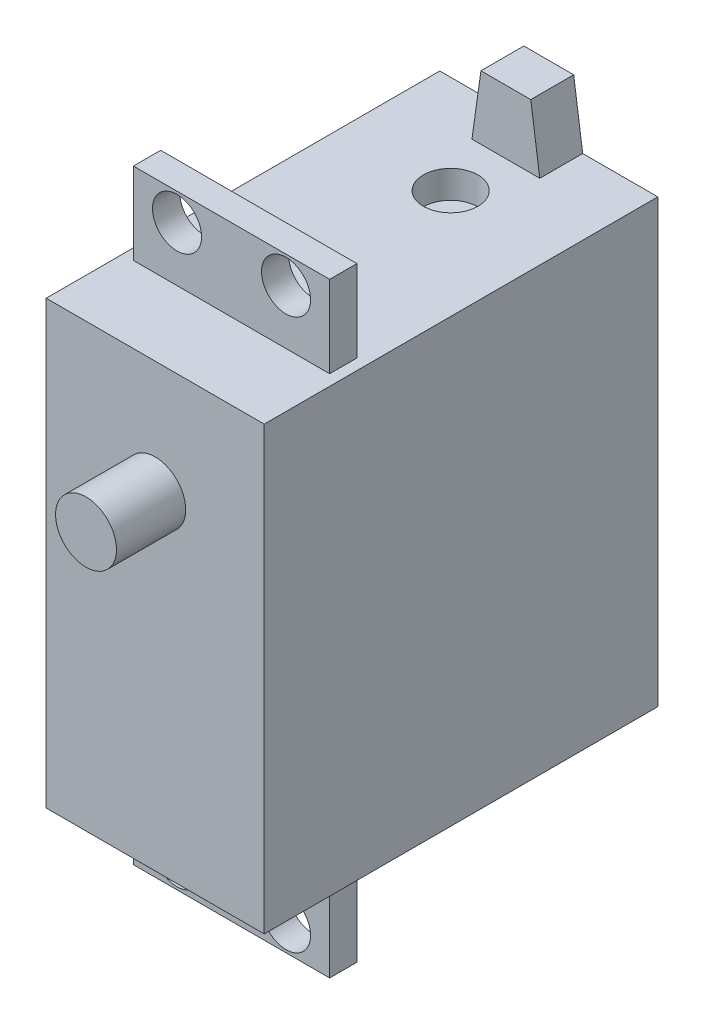
from build123d import *

# Parameters (mm, degrees)
SKETCH1_W           = 20
SKETCH1_H           = 40.5
BOSS_EXTRUDE1_DEPTH = 9.50000005
SKETCH2_W           = 20
SKETCH2_H           = 40.5
BOSS_EXTRUDE2_DEPTH = 17.1
SKETCH3_R           = 2.25
BOSS_EXTRUDE3_DEPTH = 2.5
SKETCH4_R           = 2.794
BOSS_EXTRUDE4_DEPTH = 6.349000002
SKETCH7_R           = 2.5
CUT_EXTRUDE1_DEPTH  = 2.54
BOSS_EXTRUDE6_DEPTH = 3.937


with BuildPart() as part:
    # Sketch1 → Boss-Extrude1 (new, symmetric)
    with BuildSketch(Plane.XY):
        with Locations((10, 20.25)):
            Rectangle(SKETCH1_W, SKETCH1_H)
    extrude(amount=BOSS_EXTRUDE1_DEPTH, both=True)

    # Sketch2 → Boss-Extrude2 (add)
    with BuildSketch(Plane(origin=(0, 0, -9.50000005), x_dir=(-1, 0, 0), z_dir=(0, 0, -1))):
        with Locations((-10, 20.25)):
            Rectangle(SKETCH2_W, SKETCH2_H)
    extrude(amount=BOSS_EXTRUDE2_DEPTH)

    # Sketch3 → Boss-Extrude3 (add)
    with BuildSketch(Plane.XY):
        Polygon((19, 0), (19, -7.5), (1, -7.5), (1, 0), (0, 0), (0, 40.5), (1, 40.5), (1, 48), (19, 48), (19, 40.5), (20, 40.5), (20, 0), align=None)
        with Locations((5, -5)):
            Circle(SKETCH3_R, mode=Mode.SUBTRACT)
        with Locations((15, -5)):
            Circle(SKETCH3_R, mode=Mode.SUBTRACT)
        with Locations((5, 45.5)):
            Circle(SKETCH3_R, mode=Mode.SUBTRACT)
        with Locations((15, 45.5)):
            Circle(SKETCH3_R, mode=Mode.SUBTRACT)
    extrude(amount=BOSS_EXTRUDE3_DEPTH)

    # Sketch4 → Boss-Extrude4 (add)
    with BuildSketch(Plane.XY.offset(9.50000005)):
        with Locations((10, 30.1)):
            Circle(SKETCH4_R)
    extrude(amount=BOSS_EXTRUDE4_DEPTH)

    # Sketch7 → Cut-Extrude1 (cut)
    with BuildSketch(Plane(origin=(0, 40.5, 0), x_dir=(1, 0, 0), z_dir=(0, 1, 0))):
        with Locations((10, 17.60000005)):
            Circle(SKETCH7_R)
    extrude(amount=-CUT_EXTRUDE1_DEPTH, mode=Mode.SUBTRACT)

    # Sketch9 → Boss-Extrude6 (add)
    with BuildSketch(Plane(origin=(0, 0, -26.60000005), x_dir=(-1, 0, 0), z_dir=(0, 0, -1))):
        Polygon((-13.1115, 40.5), (-6.8885, 40.5), (-7.714, 46.342), (-12.286, 46.342), align=None)
    extrude(amount=-BOSS_EXTRUDE6_DEPTH)


solid = part.part
